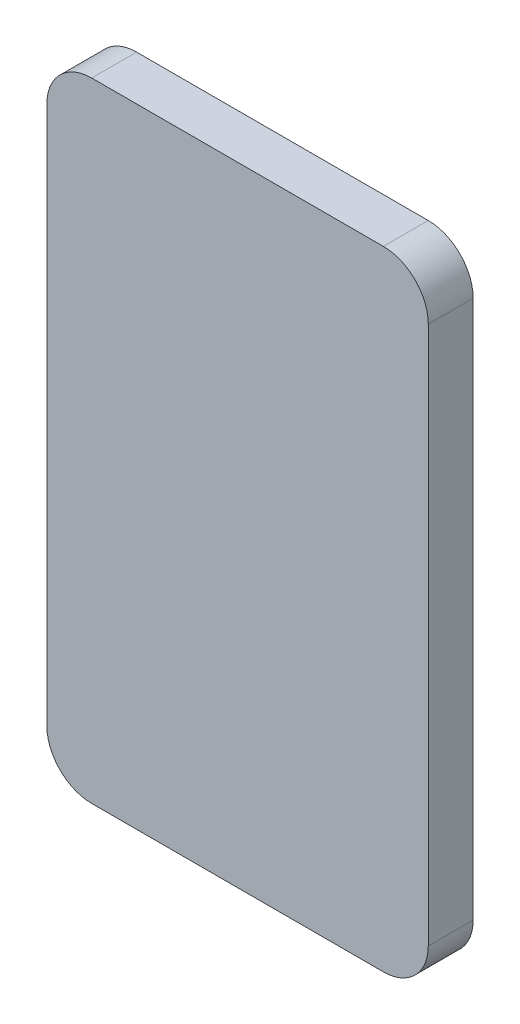
from build123d import *

# Parameters (mm, degrees)
SKETCH1_W           = 17
SKETCH1_H           = 28
BOSS_EXTRUDE1_DEPTH = 2
FILLET1_R           = 2


with BuildPart() as part:
    # Sketch1 → Boss-Extrude1 (new body)
    with BuildSketch(Plane.XY):
        with Locations((8.5, 14)):
            Rectangle(SKETCH1_W, SKETCH1_H)
    extrude(amount=BOSS_EXTRUDE1_DEPTH)

    # Fillet1
    fillet1_edges = [part.edges().sort_by_distance(p)[0] for p in [
        (17, 0, 1),
        (0, 0, 1),
        (0, 28, 1),
        (17, 28, 1),
    ]]
    fillet(fillet1_edges, radius=FILLET1_R)


solid = part.part
